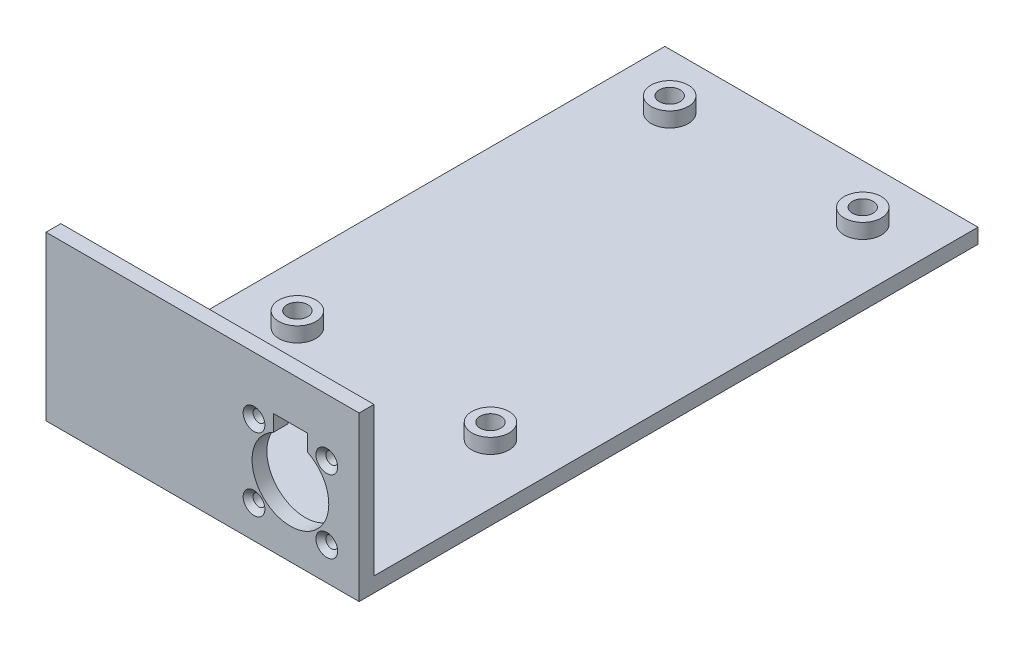
from build123d import *

# Parameters (mm, degrees)
SKETCH_2_R                  = 3.75
EXTRUDE_1_DEPTH             = 3
EXTRUDE_1_2_DEPTH           = 3
EXTRUDE_1_3_DEPTH           = 3
EXTRUDE_1_4_DEPTH           = 3
SKETCH_3_W                  = 63.25
SKETCH_3_H                  = 125
EXTRUDE_2_DEPTH             = 3
SKETCH_4_R                  = 2.1
CUT_EXTRUDE_1_DEPTH         = 4
SKETCH_5_W                  = 63.25
SKETCH_5_H                  = 3
EXTRUDE_3_DEPTH             = 30
CUT_EXTRUDE_2_DEPTH         = 10
HOLE_WIZARD_M21_D           = 2.4
HOLE_WIZARD_M21_DEPTH       = 5
HOLE_WIZARD_M21_CSINK_D     = 4.4
HOLE_WIZARD_M21_CSINK_ANGLE = 90
HOLE_WIZARD_M21_TIP         = 0.721032743


with BuildPart() as part:
    # Эскиз2 → Бобышка-Вытянуть1 (new body)
    with BuildSketch(Plane.XZ):
        with Locations((19.5, 37.6)):
            Circle(SKETCH_2_R)
    extrude(amount=EXTRUDE_1_DEPTH)



with BuildPart() as body_2:
    # Эскиз2 → Extrude 1 2 (new body)
    with BuildSketch(Plane.XZ):
        with Locations((19.5, -37.6)):
            Circle(SKETCH_2_R)
    extrude(amount=EXTRUDE_1_2_DEPTH)


with BuildPart() as body_3:
    # Эскиз2 → Extrude 1 3 (new body)
    with BuildSketch(Plane.XZ):
        with Locations((-19.5, -37.6)):
            Circle(SKETCH_2_R)
    extrude(amount=EXTRUDE_1_3_DEPTH)


with BuildPart() as body_4:
    # Эскиз2 → Extrude 1 4 (new body)
    with BuildSketch(Plane.XZ):
        with Locations((-19.5, 37.6)):
            Circle(SKETCH_2_R)
    extrude(amount=EXTRUDE_1_4_DEPTH)


with BuildPart() as part_1:
    add(part.part)

    add(body_2.part)  # Бобышка-Вытянуть2 merges body 2

    add(body_3.part)  # Бобышка-Вытянуть2 merges body 3

    add(body_4.part)  # Бобышка-Вытянуть2 merges body 4
    # Эскиз3 → Бобышка-Вытянуть2 (add)
    with BuildSketch(Plane.XZ.offset(3)):
        with Locations((0, 13.75)):
            Rectangle(SKETCH_3_W, SKETCH_3_H)
    extrude(amount=EXTRUDE_2_DEPTH)

    # Эскиз4 → Вырез-Вытянуть1 (cut)
    with BuildSketch(Plane(origin=(0, 0, 0), x_dir=(1, 0, 0), z_dir=(0, 1, 0))):
        with Locations((19.5, 37.6)):
            Circle(SKETCH_4_R)
        with Locations((19.5, -37.6)):
            Circle(SKETCH_4_R)
        with Locations((-19.5, -37.6)):
            Circle(SKETCH_4_R)
        with Locations((-19.5, 37.6)):
            Circle(SKETCH_4_R)
    extrude(amount=-CUT_EXTRUDE_1_DEPTH, mode=Mode.SUBTRACT)

    # Эскиз5 → Бобышка-Вытянуть3 (add)
    with BuildSketch(Plane(origin=(0, -3, 0), x_dir=(1, 0, 0), z_dir=(0, 1, 0))):
        with Locations((0, -74.75)):
            Rectangle(SKETCH_5_W, SKETCH_5_H)
    extrude(amount=EXTRUDE_3_DEPTH)

    # Эскиз8 → Вырез-Вытянуть2 (cut)
    with BuildSketch(Plane.XY.offset(76.25)):
        with BuildLine():
            Line((21.19307584, 14.939740629), (21.19307584, 18.25))
            Line((21.19307584, 18.25), (14.29307584, 18.25))
            Line((14.29307584, 18.25), (14.29307584, 14.939740629))
            ThreePointArc((14.29307584, 14.939740629), (17.74307584, 0.25), (21.19307584, 14.939740629))
        make_face()
    extrude(amount=-CUT_EXTRUDE_2_DEPTH, mode=Mode.SUBTRACT)

    # Зенковка для винта с полупотайной головкой M21
    with Locations(Plane.XY.offset(76.25)):
        with Locations((10.39307584, 0.65), (25.09307584, 0.65), (10.39307584, 15.35), (25.09307584, 15.35)):
            CounterSinkHole(HOLE_WIZARD_M21_D / 2, HOLE_WIZARD_M21_CSINK_D / 2, depth=HOLE_WIZARD_M21_DEPTH, counter_sink_angle=HOLE_WIZARD_M21_CSINK_ANGLE)
            with Locations((0, 0, -(HOLE_WIZARD_M21_DEPTH + HOLE_WIZARD_M21_TIP / 2))):  # 118° drill point
                Cone(0, HOLE_WIZARD_M21_D / 2, HOLE_WIZARD_M21_TIP, mode=Mode.SUBTRACT)


solid = part_1.part
